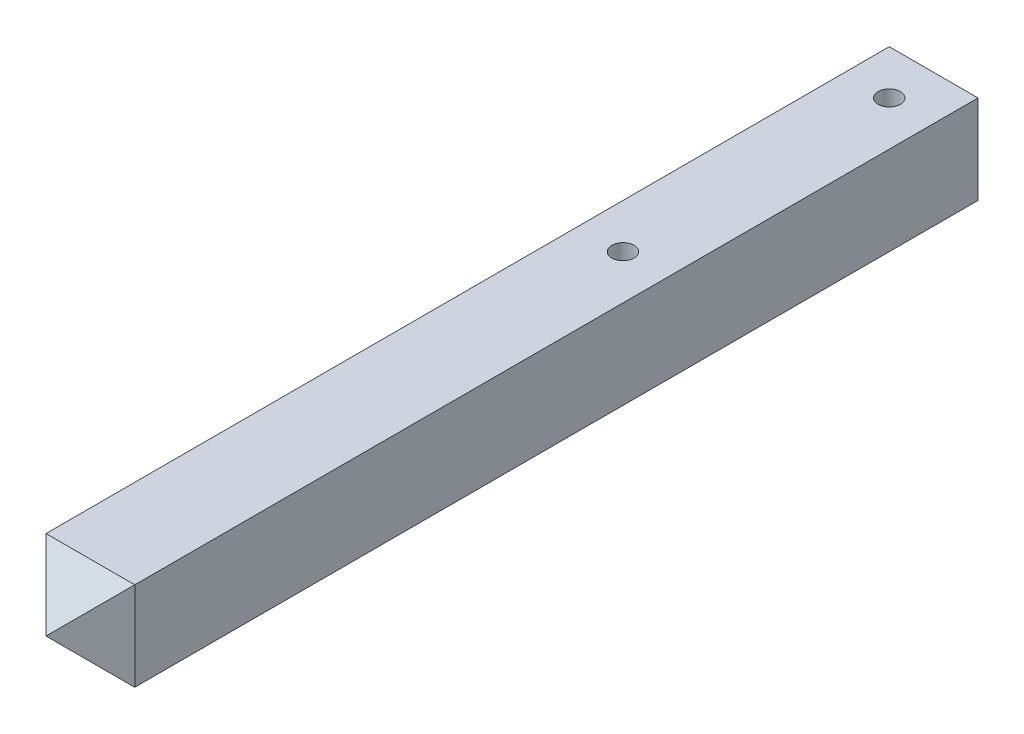
from build123d import *

# Parameters (mm, degrees)
SKETCH1_W           = 20
SKETCH1_H           = 200
SKETCH1_R           = 2.5
BOSS_EXTRUDE1_DEPTH = 20
CHAMFER1_SIZE       = 10


with BuildPart() as part:
    # Sketch1 → Boss-Extrude1 (new body)
    with BuildSketch(Plane(origin=(0, 0, 0), x_dir=(1, 0, 0), z_dir=(0, 1, 0))):
        with Locations((10, -100)):
            Rectangle(SKETCH1_W, SKETCH1_H)
        with Locations(Location((10, -10, 0), (0, 0, 270))):
            Circle(SKETCH1_R, mode=Mode.SUBTRACT)
        with Locations(Location((10, -70, 0), (0, 0, 270))):
            Circle(SKETCH1_R, mode=Mode.SUBTRACT)
    extrude(amount=BOSS_EXTRUDE1_DEPTH)

    # Chamfer1
    chamfer1_edges = [part.edges().sort_by_distance(p)[0] for p in [
        (10, 0, 200),
        (10, 20, 200),
        (20, 10, 200),
        (0, 10, 200),
    ]]
    chamfer(chamfer1_edges, length=CHAMFER1_SIZE - 0.0001)  # a hair under: the kernel refuses the full size


solid = part.part
